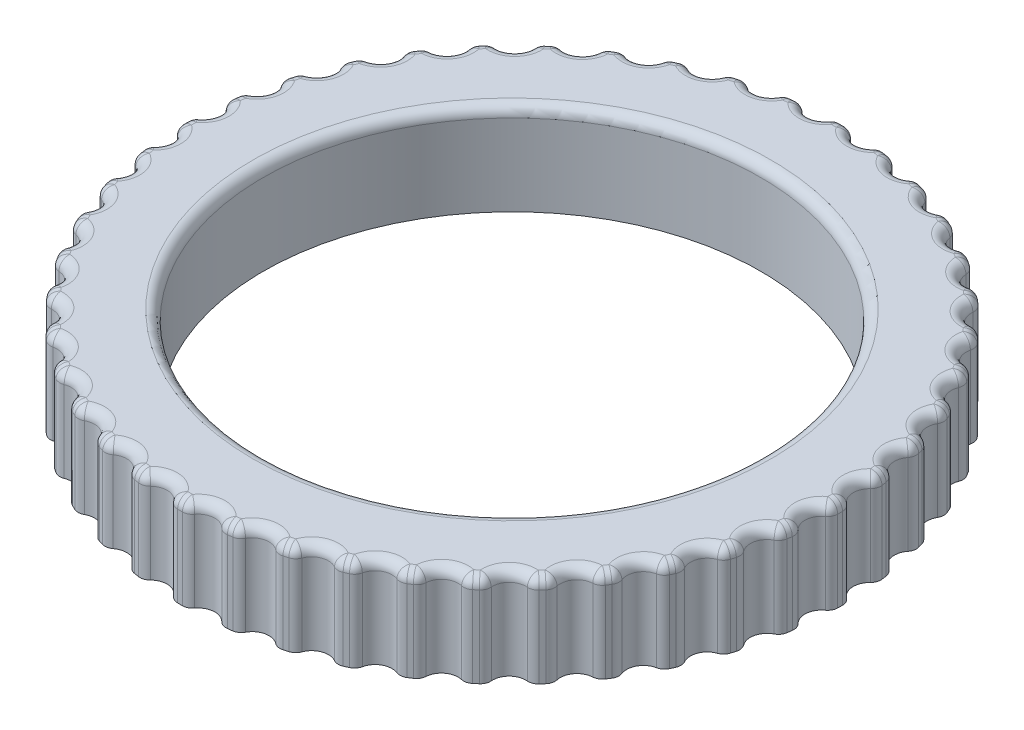
from build123d import *

# Parameters (mm, degrees)
ESQUISSE1_R             = 6.5
ESQUISSE1_R_2           = 4.9
BOSS_EXTRU_1_DEPTH      = 1.8
ESQUISSE2_R             = 0.329608801
ENL_V_MAT_EXTRU_1_DEPTH = 1.8
CONG_2_R                = 0.2
CONG_3_R                = 0.2
CONG_4_R                = 0.2


with BuildPart() as part:
    # Esquisse1 → Boss.-Extru.1 (new body)
    with BuildSketch(Plane(origin=(0, 0, 0), x_dir=(1, 0, 0), z_dir=(0, 1, 0))):
        with Locations(Location((0, 0, 0), (0, 0, 270))):
            Circle(ESQUISSE1_R)
        with Locations(Location((0, 0, 0), (0, 0, 270))):
            Circle(ESQUISSE1_R_2, mode=Mode.SUBTRACT)
    extrude(amount=BOSS_EXTRU_1_DEPTH)

    # Esquisse2 → Enlèv. mat.-Extru.1 (cut)
    with BuildSketch(Plane(origin=(0, 1.8, 0), x_dir=(1, 0, 0), z_dir=(0, 1, 0))):
        with Locations((-0.434504855, 6.615354743)):
            Circle(ESQUISSE2_R)
        with Locations((0.511380918, 6.609856459)):
            Circle(ESQUISSE2_R)
        with Locations((1.446856451, 6.469800558)):
            Circle(ESQUISSE2_R)
        with Locations((2.352878158, 6.198038175)):
            Circle(ESQUISSE2_R)
        with Locations((3.211002052, 5.800101609)):
            Circle(ESQUISSE2_R)
        with Locations((4.003759203, 5.2840917)):
            Circle(ESQUISSE2_R)
        with Locations((4.715011363, 4.660512922)):
            Circle(ESQUISSE2_R)
        with Locations((5.330279489, 3.94205954)):
            Circle(ESQUISSE2_R)
        with Locations((5.837038495, 3.143357195)):
            Circle(ESQUISSE2_R)
        with Locations((6.22497223, 2.280665162)):
            Circle(ESQUISSE2_R)
        with Locations((6.486183482, 1.371545362)):
            Circle(ESQUISSE2_R)
        with Locations((6.615354743, 0.434504855)):
            Circle(ESQUISSE2_R)
        with Locations((6.609856459, -0.511380918)):
            Circle(ESQUISSE2_R)
        with Locations((6.469800558, -1.446856451)):
            Circle(ESQUISSE2_R)
        with Locations((6.198038175, -2.352878158)):
            Circle(ESQUISSE2_R)
        with Locations((5.800101609, -3.211002052)):
            Circle(ESQUISSE2_R)
        with Locations((5.2840917, -4.003759203)):
            Circle(ESQUISSE2_R)
        with Locations((4.660512922, -4.715011363)):
            Circle(ESQUISSE2_R)
        with Locations((3.94205954, -5.330279489)):
            Circle(ESQUISSE2_R)
        with Locations((3.143357195, -5.837038495)):
            Circle(ESQUISSE2_R)
        with Locations((2.280665162, -6.22497223)):
            Circle(ESQUISSE2_R)
        with Locations((1.371545362, -6.486183482)):
            Circle(ESQUISSE2_R)
        with Locations((0.434504855, -6.615354743)):
            Circle(ESQUISSE2_R)
        with Locations((-0.511380918, -6.609856459)):
            Circle(ESQUISSE2_R)
        with Locations((-1.446856451, -6.469800558)):
            Circle(ESQUISSE2_R)
        with Locations((-2.352878158, -6.198038175)):
            Circle(ESQUISSE2_R)
        with Locations((-3.211002052, -5.800101609)):
            Circle(ESQUISSE2_R)
        with Locations((-4.003759203, -5.2840917)):
            Circle(ESQUISSE2_R)
        with Locations((-4.715011363, -4.660512922)):
            Circle(ESQUISSE2_R)
        with Locations((-5.330279489, -3.94205954)):
            Circle(ESQUISSE2_R)
        with Locations((-5.837038495, -3.143357195)):
            Circle(ESQUISSE2_R)
        with Locations((-6.22497223, -2.280665162)):
            Circle(ESQUISSE2_R)
        with Locations((-6.486183482, -1.371545362)):
            Circle(ESQUISSE2_R)
        with Locations((-6.615354743, -0.434504855)):
            Circle(ESQUISSE2_R)
        with Locations((-6.609856459, 0.511380918)):
            Circle(ESQUISSE2_R)
        with Locations((-6.469800558, 1.446856451)):
            Circle(ESQUISSE2_R)
        with Locations((-6.198038175, 2.352878158)):
            Circle(ESQUISSE2_R)
        with Locations((-5.800101609, 3.211002052)):
            Circle(ESQUISSE2_R)
        with Locations((-5.2840917, 4.003759203)):
            Circle(ESQUISSE2_R)
        with Locations((-4.660512922, 4.715011363)):
            Circle(ESQUISSE2_R)
        with Locations((-3.94205954, 5.330279489)):
            Circle(ESQUISSE2_R)
        with Locations((-3.143357195, 5.837038495)):
            Circle(ESQUISSE2_R)
        with Locations((-2.280665162, 6.22497223)):
            Circle(ESQUISSE2_R)
        with Locations((-1.371545362, 6.486183482)):
            Circle(ESQUISSE2_R)
    extrude(amount=-ENL_V_MAT_EXTRU_1_DEPTH, mode=Mode.SUBTRACT)

    # Congé2
    cong_2_edges = [part.edges().sort_by_distance(p)[0] for p in [
        (6.163705457, 1.8, -1.303355302),
        (6.439107736, 1.8, -0.887632561),
        (6.286454621, 1.8, -0.41290228),
        (6.499890188, 1.8, 0.037782835),
        (6.281229699, 1.8, 0.485956243),
        (6.42835362, 1.8, 0.962429081),
        (6.148137053, 1.8, 1.374922098),
        (-0.41290228, 1.8, -6.286454621),
        (6.22595431, 1.8, 1.867483046),
        (5.889886067, 1.8, 2.235898504),
        (5.896812525, 1.8, 2.734520442),
        (5.511733985, 1.8, 3.051358464),
        (5.447628641, 1.8, 3.545890888),
        (5.021378894, 1.8, 3.804701565),
        (4.887546748, 1.8, 4.28507722),
        (4.428803009, 1.8, 4.480591915),
        (4.227968498, 1.8, 4.937031738),
        (3.746069467, 1.8, 5.065270333),
        (3.482321001, 1.8, 5.488482526),
        (2.987076753, 1.8, 5.546834455),
        (2.665783492, 1.8, 5.928203638),
        (0.037782835, 1.8, -6.499890188),
        (2.16727577, 1.8, 5.915481023),
        (1.794978317, 1.8, 6.247243619),
        (1.303355302, 1.8, 6.163705457),
        (0.887632561, 1.8, 6.439107736),
        (0.41290228, 1.8, 6.286454621),
        (-0.037782835, 1.8, 6.499890188),
        (-0.485956243, 1.8, 6.281229699),
        (0.485956243, 1.8, -6.281229699),
        (-0.962429081, 1.8, 6.42835362),
        (-1.374922098, 1.8, 6.148137053),
        (-1.867483046, 1.8, 6.22595431),
        (-2.235898504, 1.8, 5.889886067),
        (-2.734520442, 1.8, 5.896812525),
        (-3.051358464, 1.8, 5.511733985),
        (-3.545890888, 1.8, 5.447628641),
        (-3.804701565, 1.8, 5.021378894),
        (-4.28507722, 1.8, 4.887546748),
        (-4.480591915, 1.8, 4.428803009),
        (-4.937031738, 1.8, 4.227968498),
        (-5.065270333, 1.8, 3.746069467),
        (-5.488482526, 1.8, 3.482321001),
        (-5.546834455, 1.8, 2.987076753),
        (0.962429081, 1.8, -6.42835362),
        (-5.928203638, 1.8, 2.665783492),
        (-5.915481023, 1.8, 2.16727577),
        (-6.247243619, 1.8, 1.794978317),
        (-6.163705457, 1.8, 1.303355302),
        (1.374922098, 1.8, -6.148137053),
        (-6.439107736, 1.8, 0.887632561),
        (-6.286454621, 1.8, 0.41290228),
        (-6.499890188, 1.8, -0.037782835),
        (-6.281229699, 1.8, -0.485956243),
        (-6.42835362, 1.8, -0.962429081),
        (-6.148137053, 1.8, -1.374922098),
        (-6.22595431, 1.8, -1.867483046),
        (-5.889886067, 1.8, -2.235898504),
        (-5.896812525, 1.8, -2.734520442),
        (-5.511733985, 1.8, -3.051358464),
        (-5.447628641, 1.8, -3.545890888),
        (-5.021378894, 1.8, -3.804701565),
        (-4.887546748, 1.8, -4.28507722),
        (-4.428803009, 1.8, -4.480591915),
        (-4.227968498, 1.8, -4.937031738),
        (-3.746069467, 1.8, -5.065270333),
        (1.867483046, 1.8, -6.22595431),
        (-3.482321001, 1.8, -5.488482526),
        (-2.987076753, 1.8, -5.546834455),
        (-2.665783492, 1.8, -5.928203638),
        (-2.16727577, 1.8, -5.915481023),
        (2.235898504, 1.8, -5.889886067),
        (-1.794978317, 1.8, -6.247243619),
        (-1.303355302, 1.8, -6.163705457),
        (2.734520442, 1.8, -5.896812525),
        (3.051358464, 1.8, -5.511733985),
        (3.545890888, 1.8, -5.447628641),
        (3.804701565, 1.8, -5.021378894),
        (4.28507722, 1.8, -4.887546748),
        (4.480591915, 1.8, -4.428803009),
        (4.937031738, 1.8, -4.227968498),
        (5.065270333, 1.8, -3.746069467),
        (5.488482526, 1.8, -3.482321001),
        (5.546834455, 1.8, -2.987076753),
        (5.928203638, 1.8, -2.665783492),
        (5.915481023, 1.8, -2.16727577),
        (-0.887632561, 1.8, -6.439107736),
        (6.247243619, 1.8, -1.794978317),
    ]]
    fillet(cong_2_edges, radius=CONG_2_R - 0.0001)  # a hair under: the kernel refuses the full size

    # Congé3
    cong_3_edges = [part.edges().sort_by_distance(p)[0] for p in [
        (0, 1.8, -4.9),
    ]]
    fillet(cong_3_edges, radius=CONG_3_R)

    # Congé4
    cong_4_edges = [part.edges().sort_by_distance(p)[0] for p in [
        (6.41466627, 0.80005, -1.049788856),
        (-0.126201326, 0.80005, -6.498774748),
        (6.498774748, 0.80005, -0.126201326),
        (6.450586913, 0.80005, 0.799955299),
        (6.27108373, 0.80005, 1.709827141),
        (5.963919367, 0.80005, 2.584891833),
        (5.535346804, 0.80005, 3.407335581),
        (4.994090542, 0.80005, 4.160415803),
        (4.351168999, 0.80005, 4.828801957),
        (3.619670203, 0.80005, 5.398887628),
        (2.81448536, 0.80005, 5.859067516),
        (1.952005711, 0.80005, 6.199973686),
        (0.799955299, 0.80005, -6.450586913),
        (1.049788856, 0.80005, 6.41466627),
        (0.126201326, 0.80005, 6.498774748),
        (-0.799955299, 0.80005, 6.450586913),
        (-1.709827141, 0.80005, 6.27108373),
        (-2.584891833, 0.80005, 5.963919367),
        (-3.407335581, 0.80005, 5.535346804),
        (-4.160415803, 0.80005, 4.994090542),
        (-4.828801957, 0.80005, 4.351168999),
        (-5.398887628, 0.80005, 3.619670203),
        (-5.859067516, 0.80005, 2.81448536),
        (-6.199973686, 0.80005, 1.952005711),
        (-6.41466627, 0.80005, 1.049788856),
        (-6.498774748, 0.80005, 0.126201326),
        (1.709827141, 0.80005, -6.27108373),
        (-6.450586913, 0.80005, -0.799955299),
        (-6.27108373, 0.80005, -1.709827141),
        (-5.963919367, 0.80005, -2.584891833),
        (-5.535346804, 0.80005, -3.407335581),
        (-4.994090542, 0.80005, -4.160415803),
        (-4.351168999, 0.80005, -4.828801957),
        (-3.619670203, 0.80005, -5.398887628),
        (-2.81448536, 0.80005, -5.859067516),
        (-1.952005711, 0.80005, -6.199973686),
        (-1.049788856, 0.80005, -6.41466627),
        (2.584891833, 0.80005, -5.963919367),
        (-0.72491129, 0.80005, -6.459450721),
        (0.201742947, 0.80005, -6.49686846),
        (1.124290279, 0.80005, -6.402028692),
        (2.023950302, 0.80005, -6.176862081),
        (2.882408535, 0.80005, -5.825952372),
        (3.682189242, 0.80005, -5.356443072),
        (4.407011194, 0.80005, -4.777892039),
        (5.042119107, 0.80005, -4.102076902),
        (5.574584016, 0.80005, -3.342755308),
        (5.993566469, 0.80005, -2.515384857),
        (6.290537194, 0.80005, -1.636808423),
        (6.459450721, 0.80005, -0.72491129),
        (6.49686846, 0.80005, 0.201742947),
        (6.402028692, 0.80005, 1.124290279),
        (6.176862081, 0.80005, 2.023950302),
        (3.407335581, 0.80005, -5.535346804),
        (5.825952372, 0.80005, 2.882408535),
        (5.356443073, 0.80005, 3.682189242),
        (4.777892039, 0.80005, 4.407011194),
        (4.102076902, 0.80005, 5.042119107),
        (3.342755308, 0.80005, 5.574584016),
        (2.515384857, 0.80005, 5.993566469),
        (1.636808423, 0.80005, 6.290537194),
        (0.72491129, 0.80005, 6.459450721),
        (-0.201742947, 0.80005, 6.49686846),
        (-1.124290279, 0.80005, 6.402028692),
        (-2.023950302, 0.80005, 6.176862081),
        (-2.882408535, 0.80005, 5.825952372),
        (-3.682189242, 0.80005, 5.356443073),
        (-4.407011194, 0.80005, 4.777892039),
        (-5.042119107, 0.80005, 4.102076902),
        (-5.574584016, 0.80005, 3.342755308),
        (-5.993566469, 0.80005, 2.515384857),
        (-6.290537194, 0.80005, 1.636808423),
        (-6.459450721, 0.80005, 0.72491129),
        (-6.49686846, 0.80005, -0.201742947),
        (-6.402028692, 0.80005, -1.124290279),
        (-6.176862081, 0.80005, -2.023950302),
        (-5.825952372, 0.80005, -2.882408535),
        (-5.356443072, 0.80005, -3.682189242),
        (-4.777892039, 0.80005, -4.407011194),
        (-4.102076902, 0.80005, -5.042119107),
        (-3.342755308, 0.80005, -5.574584016),
        (-2.515384857, 0.80005, -5.993566469),
        (-1.636808423, 0.80005, -6.290537194),
        (1.000389036, 1.745488264, 6.359086342),
        (0.757431005, 1.745488264, 6.392578164),
        (1.659480177, 1.745488264, 6.219717264),
        (0.085214173, 1.745488265, 6.436730214),
        (1.895198862, 1.745488264, 6.151989808),
        (-0.160037278, 1.745488264, 6.435304607),
        (2.527747119, 1.745488264, 5.920240858),
        (-0.831695404, 1.745488263, 6.383340824),
        (2.751427905, 1.745488264, 5.819656502),
        (-1.074247663, 1.745488264, 6.347026805),
        (3.344556418, 1.745488264, 5.50024542),
        (-1.731674061, 1.745488264, 6.200005022),
        (3.55164581, 1.745488264, 5.368851773),
        (-1.966589464, 1.745488264, 6.129541842),
        (4.093280193, 1.745488264, 4.968280846),
        (-2.596400828, 1.745488264, 5.890454996),
        (4.279562448, 1.745488264, 4.808752704),
        (-2.818897176, 1.745488264, 5.787277083),
        (4.758676588, 1.745488264, 4.335176402),
        (-3.408272361, 1.745488265, 5.460992293),
        (4.920359537, 1.745488264, 4.150761298),
        (-3.613820269, 1.745488264, 5.327200051),
        (5.32720005, 1.745488264, 3.613820268),
        (-4.150761298, 1.745488264, 4.920359536),
        (5.460992294, 1.745488264, 3.408272361),
        (-4.335176403, 1.745488264, 4.758676588),
        (5.787277082, 1.745488264, 2.818897175),
        (-4.808752704, 1.745488264, 4.279562448),
        (5.890454996, 1.745488264, 2.596400827),
        (-4.968280847, 1.745488264, 4.093280193),
        (6.129541842, 1.745488264, 1.966589464),
        (-5.368851773, 1.745488265, 3.551645809),
        (6.200005022, 1.745488264, 1.731674061),
        (-5.500245421, 1.745488264, 3.344556418),
        (6.347026805, 1.745488264, 1.074247663),
        (-5.819656502, 1.745488265, 2.751427904),
        (6.383340824, 1.745488264, 0.831695404),
        (-5.920240859, 1.745488264, 2.527747118),
        (6.435304607, 1.745488264, 0.160037278),
        (-6.151989808, 1.745488264, 1.895198862),
        (6.436730215, 1.745488264, -0.085214173),
        (-6.219717266, 1.745488264, 1.659480177),
        (6.392578164, 1.745488264, -0.757431005),
        (-6.359086341, 1.745488264, 1.000389035),
        (6.359086342, 1.745488264, -1.000389036),
        (-6.392578165, 1.745488264, 0.757431005),
        (6.219717266, 1.745488263, -1.659480177),
        (-6.436730214, 1.745488265, 0.085214173),
        (6.151989808, 1.745488264, -1.895198862),
        (-6.435304607, 1.745488264, -0.160037278),
        (5.920240858, 1.745488264, -2.527747119),
        (-6.383340824, 1.745488264, -0.831695404),
        (5.819656503, 1.745488263, -2.751427905),
        (-6.347026806, 1.745488264, -1.074247664),
        (5.50024542, 1.745488264, -3.344556418),
        (-6.20000502, 1.745488265, -1.731674061),
        (5.368851773, 1.745488264, -3.55164581),
        (-6.129541842, 1.745488264, -1.966589465),
        (4.968280846, 1.745488264, -4.093280193),
        (-5.890454996, 1.745488264, -2.596400828),
        (4.808752704, 1.745488264, -4.279562448),
        (-5.787277083, 1.745488264, -2.818897176),
        (4.160415803, 0.80005, -4.994090542),
        (4.335176402, 1.745488264, -4.758676588),
        (-5.460992293, 1.745488265, -3.408272361),
        (4.150761298, 1.745488264, -4.920359537),
        (-5.327200051, 1.745488264, -3.613820269),
        (3.613820268, 1.745488264, -5.32720005),
        (-4.920359535, 1.745488265, -4.150761298),
        (3.408272361, 1.745488264, -5.460992294),
        (-4.758676588, 1.745488264, -4.335176403),
        (2.818897175, 1.745488264, -5.787277082),
        (-4.279562448, 1.745488264, -4.808752704),
        (2.596400828, 1.745488264, -5.890454996),
        (-4.093280193, 1.745488264, -4.968280848),
        (1.966589464, 1.745488264, -6.129541842),
        (-3.55164581, 1.745488264, -5.368851773),
        (1.731674061, 1.745488264, -6.200005022),
        (-3.344556418, 1.745488264, -5.500245421),
        (1.074247663, 1.745488264, -6.347026805),
        (-2.751427904, 1.745488265, -5.819656502),
        (0.831695404, 1.745488264, -6.383340824),
        (-2.527747119, 1.745488264, -5.920240858),
        (0.160037278, 1.745488264, -6.435304607),
        (-1.895198862, 1.745488264, -6.151989808),
        (-0.085214173, 1.745488264, -6.436730215),
        (-1.659480177, 1.745488264, -6.219717264),
        (-0.757431005, 1.745488263, -6.392578165),
        (-1.000389036, 1.745488264, -6.359086342),
        (4.828801957, 0.80005, -4.351168999),
        (5.398887628, 0.80005, -3.619670203),
        (5.859067516, 0.80005, -2.81448536),
        (6.199973686, 0.80005, -1.952005711),
    ]]
    fillet(cong_4_edges, radius=CONG_4_R)


solid = part.part
